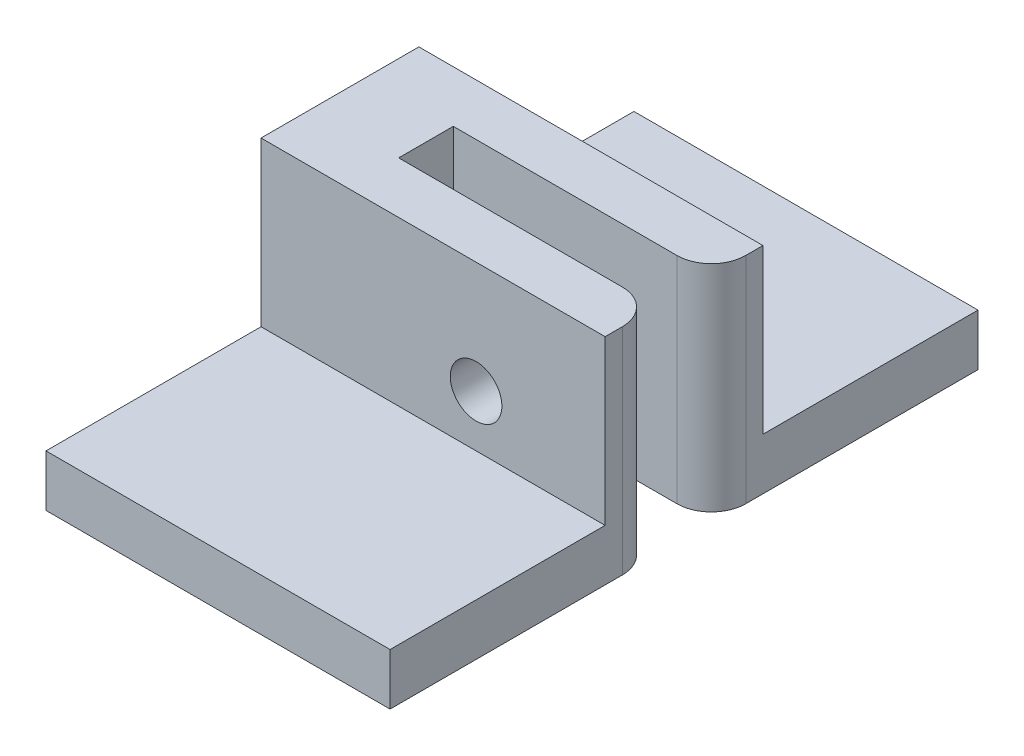
from build123d import *

# Parameters (mm, degrees)
BOSS_EXTRUDE1_DEPTH = 20
SKETCH2_W           = 3.175
SKETCH2_H           = 12.5
CUT_EXTRUDE1_DEPTH  = 15
SKETCH3_R           = 1.5
CUT_EXTRUDE2_DEPTH  = 33.032103037
FILLET1_R           = 2
SCALE1_SCALE        = 1.02


with BuildPart() as part:
    # Sketch1 → Boss-Extrude1 (new body)
    with BuildSketch(Plane(origin=(0, 0, 0), x_dir=(0, 0, -1), z_dir=(1, 0, 0))):
        Polygon((0, 12.5), (3, 12.5), (3, 3), (15.5, 3), (15.5, 0), (0, 0), (-3.175, 0), (-18.675, 0), (-18.675, 3), (-6.175, 3), (-6.175, 12.5), (-3.175, 12.5), align=None)
    extrude(amount=BOSS_EXTRUDE1_DEPTH)

    # Sketch2 → Cut-Extrude1 (cut)
    with BuildSketch(Plane(origin=(20, 0, 0), x_dir=(0, 0, -1), z_dir=(1, 0, 0))):
        with Locations((-1.5875, 6.25)):
            Rectangle(SKETCH2_W, SKETCH2_H)
    extrude(amount=-CUT_EXTRUDE1_DEPTH, mode=Mode.SUBTRACT)

    # Sketch3 → Cut-Extrude2 (cut, through all)
    with BuildSketch(Plane.XY.offset(6.175)):
        with Locations((12.5, 6)):
            Circle(SKETCH3_R)
    extrude(amount=-CUT_EXTRUDE2_DEPTH, mode=Mode.SUBTRACT)

    # Fillet1
    fillet1_edges = [part.edges().sort_by_distance(p)[0] for p in [
        (20, 6.25, 3.175),
        (20, 6.25, 0),
    ]]
    fillet(fillet1_edges, radius=FILLET1_R)


with BuildPart() as part_1:
    # Scale1: scaled about (9.425973194, 3.980340486, 1.5875)
    add(part.part.scale(SCALE1_SCALE).moved(Location((-0.188519464, -0.07960681, -0.03175))))


solid = part_1.part
